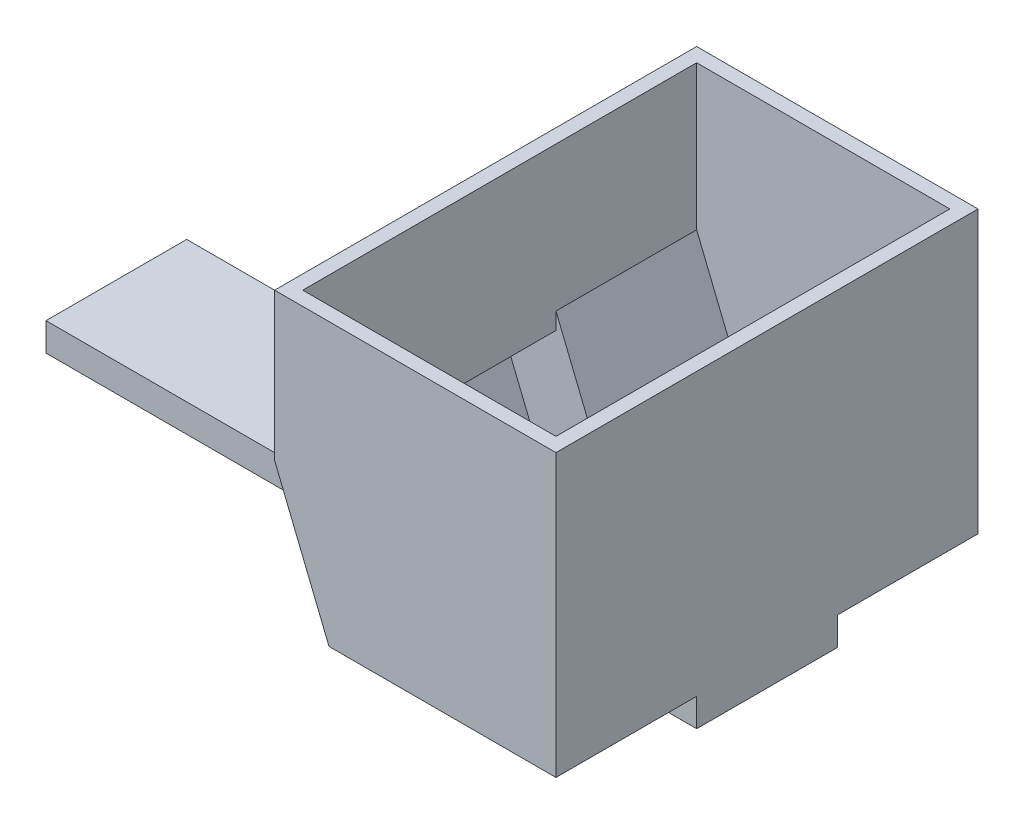
from build123d import *

# Parameters (mm, degrees)
SKETCH14_R               = 100
SKETCH14_W               = 9250
SKETCH14_H               = 400
BOSS_EXTRUDE1_DEPTH      = 2000
BOSS_EXTRUDE2_DEPTH      = 4000
BOSS_EXTRUDE2_DEPTH_BACK = 2000
SHELL2_START             = -1800
SHELL2_DEPTH             = 5600
SHELL2_START_2           = 200
SHELL2_2_DEPTH           = 1600
SKETCH16_R               = 100
BOSS_EXTRUDE3_DEPTH      = 400
SKETCH14_4_R             = 100
BOSS_EXTRUDE4_DEPTH      = 400


# Read off the part's stored shape, not the designer's step: Shell2
with BuildPart() as part:
    # Sketch14 → Boss-Extrude1 (new body)
    # profile 1 of 4: a face of its own
    with BuildSketch(Plane.XY):
        Polygon((4250, -482.915977061), (5023.740659122, -2387.179002407), (6023.740659122, -2387.179002407), (5250, -482.915977061), align=None)
        with Locations((5156.86100387, -1595.066332677)):
            Circle(SKETCH14_R, mode=Mode.SUBTRACT)
        with Locations((4895.353014227, -895.900869711)):
            Circle(SKETCH14_R, mode=Mode.SUBTRACT)
    # profile 2 of 4: a face of its own
    with BuildSketch(Plane.XY):
        with Locations((4625, -2587.179002407)):
            Rectangle(SKETCH14_W, SKETCH14_H)
    # profile 3 of 4: a face of its own
    with BuildSketch(Plane.XY):
        with Locations((4895.353014227, -895.900869711)):
            Circle(SKETCH14_R)
    # profile 4 of 4: a face of its own
    with BuildSketch(Plane.XY):
        with Locations((5156.86100387, -1595.066332677)):
            Circle(SKETCH14_R)
    extrude(amount=BOSS_EXTRUDE1_DEPTH)

    # Sketch14<3> → Boss-Extrude2 (add, two sides: drawn at the far end of the back side and taken through both)
    with BuildSketch(Plane.XY.offset(-BOSS_EXTRUDE2_DEPTH_BACK)):
        Polygon((5250, -482.915977061), (6023.740659122, -2387.179002407), (9250, -2387.179002407), (9250, 1612.820997593), (5250, 1612.820997593), align=None)
    extrude(amount=BOSS_EXTRUDE2_DEPTH + BOSS_EXTRUDE2_DEPTH_BACK)

    # Shell2 outline → Shell2 (cut)
    with BuildSketch(Plane.XY.offset(SHELL2_START)):
        Polygon((5450, 1612.820997593), (5450, -443.835376078), (6158.355846098, -2187.179002407), (9050, -2187.179002407), (9050, 1612.820997593), align=None)
    extrude(amount=SHELL2_DEPTH, mode=Mode.SUBTRACT)

    # Shell2 2 outline → Shell2 2 (cut)
    with BuildSketch(Plane.XY.offset(SHELL2_START_2)):
        Polygon((5450, -443.835376078), (5450, -682.915977061), (4547.143293403, -682.915977061), (5320.883952525, -2587.179002407), (9050, -2587.179002407), (9050, -2187.179002407), (6158.355846098, -2187.179002407), align=None)
    extrude(amount=SHELL2_2_DEPTH, mode=Mode.SUBTRACT)

    # Sketch16 → Boss-Extrude3 (add)
    with BuildSketch(Plane.XY.offset(2000)):
        with Locations((4895.353014227, -895.900869711)):
            Circle(SKETCH16_R)
    extrude(amount=BOSS_EXTRUDE3_DEPTH)

    # Sketch14<4> → Boss-Extrude4 (add)
    with BuildSketch(Plane.XY):
        with Locations((5156.86100387, -1595.066332677)):
            Circle(SKETCH14_4_R)
    extrude(amount=-BOSS_EXTRUDE4_DEPTH)


solid = part.part
